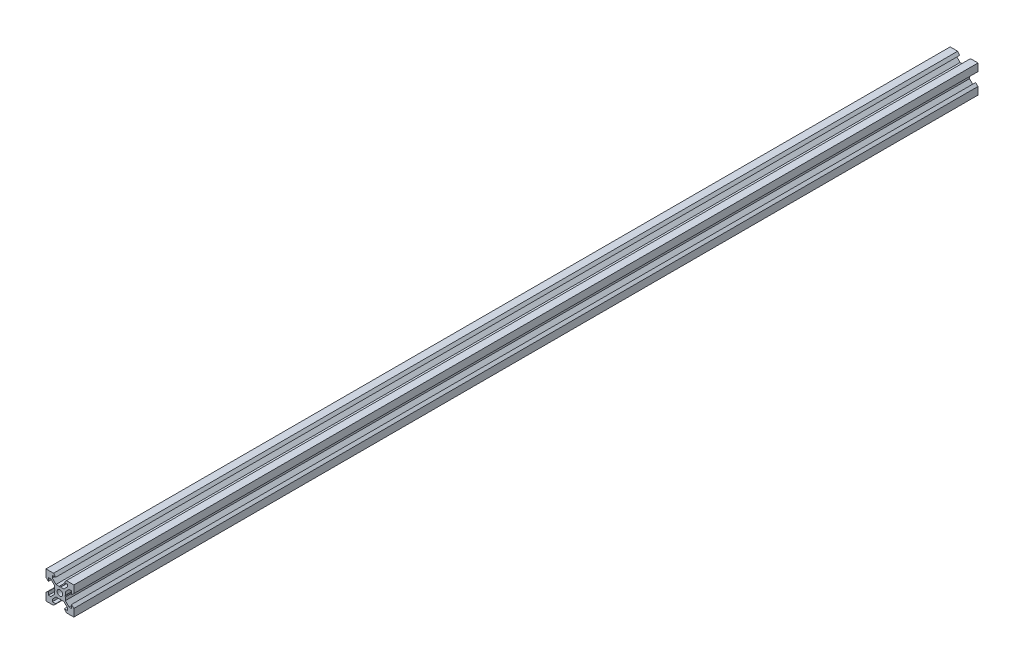
from build123d import *

# Parameters (mm, degrees)
SKETCH1_R           = 2
BOSS_EXTRUDE1_DEPTH = 324.575


with BuildPart() as part:
    # Sketch1 → Boss-Extrude1 (new, symmetric)
    with BuildSketch(Plane.XY):
        Polygon((10, 4.610379336), (10, 10), (4.610379336, 10), (3.1, 8.2), (5.5, 8.2), (5.5, 6.560660172), (2.839339828, 3.9), (0.519615242, 3.9), (0, 3.6), (-0.519615242, 3.9), (-2.839339828, 3.9), (-5.5, 6.560660172), (-5.5, 8.2), (-3.1, 8.2), (-4.610379336, 10), (-10, 10), (-10, 4.610379336), (-8.2, 3.1), (-8.2, 5.5), (-6.560660172, 5.5), (-3.9, 2.839339828), (-3.9, 0.519615242), (-3.6, 0), (-3.9, -0.519615242), (-3.9, -2.839339828), (-6.560660172, -5.5), (-8.2, -5.5), (-8.2, -3.1), (-10, -4.610379336), (-10, -10), (-4.610379336, -10), (-3.1, -8.2), (-5.5, -8.2), (-5.5, -6.560660172), (-2.839339828, -3.9), (-0.519615242, -3.9), (0, -3.6), (0.519615242, -3.9), (2.839339828, -3.9), (5.5, -6.560660172), (5.5, -8.2), (3.1, -8.2), (4.610379336, -10), (10, -10), (10, -4.610379336), (8.2, -3.1), (8.2, -5.5), (6.560660172, -5.5), (3.9, -2.839339828), (3.9, -0.519615242), (3.6, 0), (3.9, 0.519615242), (3.9, 2.839339828), (6.560660172, 5.5), (8.2, 5.5), (8.2, 3.1), align=None)
        Circle(SKETCH1_R, mode=Mode.SUBTRACT)
    extrude(amount=BOSS_EXTRUDE1_DEPTH, both=True)


solid = part.part
